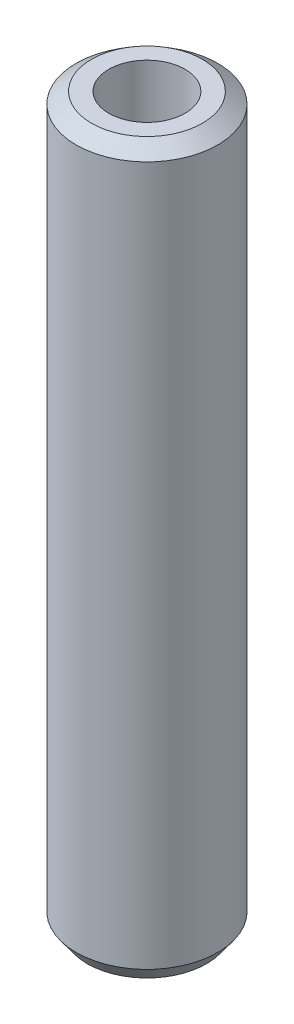
from build123d import *
from OCP.BRepFilletAPI import BRepFilletAPI_MakeChamfer

# Parameters (mm, degrees)
SKETCH1_R           = 15
BOSS_EXTRUDE1_DEPTH = 153.775560712
SKETCH2_R           = 8.083843349
CUT_EXTRUDE1_DEPTH  = 156.23183653
CHAMFER1_SIZE       = 2.356600441
CHAMFER1_SIZE2      = 3.249874134


with BuildPart() as part:
    # Sketch1 → Boss-Extrude1 (new body)
    with BuildSketch(Plane(origin=(0, 0, 0), x_dir=(1, 0, 0), z_dir=(0, 1, 0))):
        Circle(SKETCH1_R)
    extrude(amount=BOSS_EXTRUDE1_DEPTH)

    # Sketch2 → Cut-Extrude1 (cut, through all)
    with BuildSketch(Plane(origin=(0, 0, 0), x_dir=(1, 0, 0), z_dir=(0, 1, 0))):
        Circle(SKETCH2_R)
    extrude(amount=CUT_EXTRUDE1_DEPTH, mode=Mode.SUBTRACT)

    # Chamfer1: one chamfer whose edges measure the first distance from different faces: ONE call of the kernel's chamfer builder (chamfer() names one face for all edges)
    chamfer1_edges_1 = [part.edges().sort_by_distance(p)[0] for p in [
        (-15, 153.775560712, 0),
    ]]
    chamfer1_side_1 = [part.faces().sort_by_distance(p)[0] for p in [
        (-15, 76.887780356, 0),
    ]]
    chamfer1_edges_2 = [part.edges().sort_by_distance(p)[0] for p in [
        (-15, 0, 0),
    ]]
    chamfer1_side_2 = [part.faces().sort_by_distance(p)[0] for p in [
        (-14.575735931, 0, 0),
    ]]
    chamfer1 = BRepFilletAPI_MakeChamfer(part.part.solid().wrapped)
    for e in chamfer1_edges_1:
        chamfer1.Add(CHAMFER1_SIZE, CHAMFER1_SIZE2, e.wrapped, chamfer1_side_1[0].wrapped)  # the first distance lies on this face
    for e in chamfer1_edges_2:
        chamfer1.Add(CHAMFER1_SIZE, CHAMFER1_SIZE2, e.wrapped, chamfer1_side_2[0].wrapped)  # the first distance lies on this face
    add(Compound.cast(chamfer1.Shape()), mode=Mode.REPLACE)


solid = part.part
